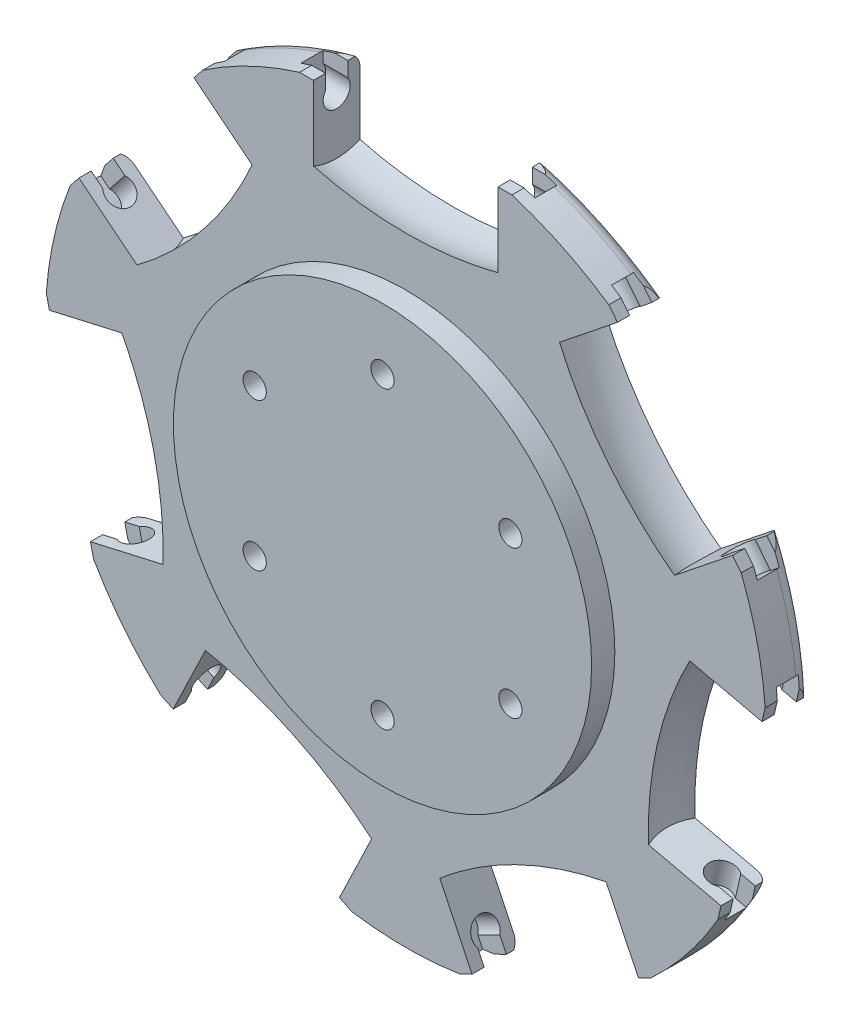
from build123d import *

# Parameters (mm, degrees)
BASE_HEPTAGONAL_DEPTH   = 5
SKETCH8_R               = 15.894039735
RELIEVE_DE_CENTRO_DEPTH = 1.324503311
CIRPATTERN2_COUNT       = 7
CUT_EXTRUDE1_START      = -5.298013245
CUT_EXTRUDE1_DEPTH      = 50.331125828
CIRPATTERN3_COUNT       = 7
SKETCH11_R              = 45.033112583
CUT_EXTRUDE3_DEPTH      = 5
SKETCH12_R              = 2.5
CUT_EXTRUDE4_DEPTH      = 116.148583309
SKETCH13_R              = 87.61589404
SKETCH13_R_2            = 77.61589404
CUT_EXTRUDE_THIN1_DEPTH = 10
SKETCH15_R              = 15.894039735
CUT_EXTRUDE6_DEPTH      = 3.5
FILLET1_R               = 3.178807947
CROQUIS1_R              = 45.0331125
CROQUIS1_R_2            = 2.5
SALIENTE_EXTRUIR1_DEPTH = 5


with BuildPart() as part:
    # Sketch2 → Base heptagonal (new, symmetric)
    with BuildSketch(Plane.XY):
        Polygon((-35.719441925, 74.17218543), (-80.260857461, 18.319016964), (-64.364210306, -51.328744916), (0, -82.324914959), (64.364210306, -51.328744916), (80.260857461, 18.319016964), (35.719441925, 74.17218543), align=None)
    extrude(amount=BASE_HEPTAGONAL_DEPTH, both=True)

    # Sketch3 → Corte De Rodillo (revolve, cut)
    with BuildSketch(Plane.XY):
        with BuildLine():
            Line((-19.870425038, 81.480316053), (-19.870425038, 69.294885589))
            Line((-19.870425038, 69.294885589), (19.870425038, 69.294885589))
            Line((19.870425038, 69.294885589), (19.870425038, 81.480316053))
            ThreePointArc((19.870425038, 81.480316053), (0, 83.868204317), (-19.870425038, 81.480316053))
        make_face()
    corte_de_rodillo = revolve(axis=Axis((-19.870425038, 69.294885589, 0), (1, 0, 0)), mode=Mode.SUBTRACT)

    # Sketch8 → Relieve de Centro (add)
    with BuildSketch(Plane.XY.offset(5)):
        Circle(SKETCH8_R)
    extrude(amount=RELIEVE_DE_CENTRO_DEPTH)

    # CirPattern2: Corte De Rodillo ×7 about axis
    cirpattern2_axis = Axis((0, 0, 0), (0, 0, 1))
    for i in range(1, CIRPATTERN2_COUNT):
        add(corte_de_rodillo.rotate(cirpattern2_axis, i * 360 / CIRPATTERN2_COUNT), mode=Mode.SUBTRACT)

    # Sketch9 → Cut-Extrude1 (cut)
    with BuildSketch(Plane(origin=(-19.870425038, 0, 0), x_dir=(0, 0, -1), z_dir=(1, 0, 0)).offset(CUT_EXTRUDE1_START)):
        with BuildLine():
            Line((2.38410596, 70.970264477), (2.38410596, 74.17218543))
            Line((2.38410596, 74.17218543), (-2.38410596, 74.17218543))
            Line((-2.38410596, 74.17218543), (-2.38410596, 70.970264477))
            ThreePointArc((-2.38410596, 70.970264477), (0, 66.380978308), (2.38410596, 70.970264477))
        make_face()
    cut_extrude1 = extrude(amount=CUT_EXTRUDE1_DEPTH, mode=Mode.SUBTRACT)

    # CirPattern3: Cut-Extrude1 ×7 about axis
    cirpattern3_axis = Axis((0, 0, 0), (0, 0, 1))
    for i in range(1, CIRPATTERN3_COUNT):
        add(cut_extrude1.rotate(cirpattern3_axis, i * 360 / CIRPATTERN3_COUNT), mode=Mode.SUBTRACT)

    # Sketch11 → Cut-Extrude3 (cut)
    with BuildSketch(Plane(origin=(0, 0, -5), x_dir=(-1, 0, 0), z_dir=(0, 0, -1))):
        Circle(SKETCH11_R)
    extrude(amount=-CUT_EXTRUDE3_DEPTH, mode=Mode.SUBTRACT)

    # Sketch12 → Cut-Extrude4 (cut, through all)
    with BuildSketch(Plane(origin=(0, 0, 0), x_dir=(-1, 0, 0), z_dir=(0, 0, -1))):
        with Locations((0, 31.78807947)):
            Circle(SKETCH12_R)
        with Locations((27.529284359, 15.894039735)):
            Circle(SKETCH12_R)
        with Locations((27.529284359, -15.894039735)):
            Circle(SKETCH12_R)
        with Locations((0, -31.78807947)):
            Circle(SKETCH12_R)
        with Locations((-27.529284359, -15.894039735)):
            Circle(SKETCH12_R)
        with Locations((-27.529284359, 15.894039735)):
            Circle(SKETCH12_R)
    extrude(amount=-CUT_EXTRUDE4_DEPTH, mode=Mode.SUBTRACT)

    # Sketch13 → Cut-Extrude-Thin1 (cut)
    with BuildSketch(Plane(origin=(0, 0, -5), x_dir=(-1, 0, 0), z_dir=(0, 0, -1))):
        Circle(SKETCH13_R)
        Circle(SKETCH13_R_2, mode=Mode.SUBTRACT)
    extrude(amount=-CUT_EXTRUDE_THIN1_DEPTH, mode=Mode.SUBTRACT)

    # Sketch15 → Cut-Extrude6 (cut)
    with BuildSketch(Plane.XY.offset(5)):
        Circle(SKETCH15_R)
    extrude(amount=CUT_EXTRUDE6_DEPTH, mode=Mode.SUBTRACT)

    # Fillet1
    # the kernel refuses this fillet: 3.178807947 mm, written as the material it takes off along each edge
    with BuildSketch(Plane(origin=(0, 0, -5), x_dir=(-0.6449730568119215, 0.7642053101010787, 0), z_dir=(-0.7642053101010787, -0.6449730568119215, 0))) as fillet1_piece_1:
        with BuildLine():
            CenterArc((77.61589404 - FILLET1_R, -FILLET1_R), FILLET1_R, 0, 90)
            Line((77.61589404 - FILLET1_R, 0), (77.61589404, 0))
            Line((77.61589404, 0), (77.61589404, -FILLET1_R))
        make_face()
    revolve(axis=Axis((0, 0, -5), (0, 0, -1)), revolution_arc=28.898739355, mode=Mode.SUBTRACT)
    with BuildSketch(Plane(origin=(0, 0, -5), x_dir=(-0.9996138939021527, -0.02778602378491304, 0), z_dir=(0.02778602378491304, -0.9996138939021527, 0))) as fillet1_piece_2:
        with BuildLine():
            CenterArc((77.61589404 - FILLET1_R, -FILLET1_R), FILLET1_R, 0, 90)
            Line((77.61589404 - FILLET1_R, 0), (77.61589404, 0))
            Line((77.61589404, 0), (77.61589404, -FILLET1_R))
        make_face()
    revolve(axis=Axis((0, 0, -5), (0, 0, -1)), revolution_arc=28.898739355, mode=Mode.SUBTRACT)
    with BuildSketch(Plane(origin=(0, 0, -5), x_dir=(-0.6015250804766251, -0.7988539150292685, 0), z_dir=(0.7988539150292685, -0.6015250804766251, 0))) as fillet1_piece_3:
        with BuildLine():
            CenterArc((77.61589404 - FILLET1_R, -FILLET1_R), FILLET1_R, 0, 90)
            Line((77.61589404 - FILLET1_R, 0), (77.61589404, 0))
            Line((77.61589404, 0), (77.61589404, -FILLET1_R))
        make_face()
    revolve(axis=Axis((0, 0, -5), (0, 0, -1)), revolution_arc=28.898739355, mode=Mode.SUBTRACT)
    with BuildSketch(Plane(origin=(0, 0, -5), x_dir=(0.24952438742324118, -0.9683685146064263, 0), z_dir=(0.9683685146064263, 0.24952438742324118, 0))) as fillet1_piece_4:
        with BuildLine():
            CenterArc((77.61589404 - FILLET1_R, -FILLET1_R), FILLET1_R, 0, 90)
            Line((77.61589404 - FILLET1_R, 0), (77.61589404, 0))
            Line((77.61589404, 0), (77.61589404, -FILLET1_R))
        make_face()
    revolve(axis=Axis((0, 0, -5), (0, 0, -1)), revolution_arc=28.898739355, mode=Mode.SUBTRACT)
    with BuildSketch(Plane(origin=(0, 0, -5), x_dir=(0.9126769022235754, -0.4086818715670883, 0), z_dir=(0.4086818715670883, 0.9126769022235754, 0))) as fillet1_piece_5:
        with BuildLine():
            CenterArc((77.61589404 - FILLET1_R, -FILLET1_R), FILLET1_R, 0, 90)
            Line((77.61589404 - FILLET1_R, 0), (77.61589404, 0))
            Line((77.61589404, 0), (77.61589404, -FILLET1_R))
        make_face()
    revolve(axis=Axis((0, 0, -5), (0, 0, -1)), revolution_arc=28.898739355, mode=Mode.SUBTRACT)
    with BuildSketch(Plane(origin=(0, 0, -5), x_dir=(0.8885650944335166, 0.45875055635318374, 0), z_dir=(-0.45875055635318374, 0.8885650944335166, 0))) as fillet1_piece_6:
        with BuildLine():
            CenterArc((77.61589404 - FILLET1_R, -FILLET1_R), FILLET1_R, 0, 90)
            Line((77.61589404 - FILLET1_R, 0), (77.61589404, 0))
            Line((77.61589404, 0), (77.61589404, -FILLET1_R))
        make_face()
    revolve(axis=Axis((0, 0, -5), (0, 0, -1)), revolution_arc=28.898739355, mode=Mode.SUBTRACT)
    with BuildSketch(Plane(origin=(0, 0, -5), x_dir=(0.19534564711037675, 0.9807344585335157, 0), z_dir=(-0.9807344585335157, 0.19534564711037675, 0))) as fillet1_piece_7:
        with BuildLine():
            CenterArc((77.61589404 - FILLET1_R, -FILLET1_R), FILLET1_R, 0, 90)
            Line((77.61589404 - FILLET1_R, 0), (77.61589404, 0))
            Line((77.61589404, 0), (77.61589404, -FILLET1_R))
        make_face()
    revolve(axis=Axis((0, 0, -5), (0, 0, -1)), revolution_arc=28.898739355, mode=Mode.SUBTRACT)

    # Croquis1 → Saliente-Extruir1 (add)
    with BuildSketch(Plane.XY.offset(5)):
        with Locations(Location((0, 0, 0), (0, 0, 180))):
            Circle(CROQUIS1_R)
        with Locations(Location((-27.529284359, -15.894039735, 0), (0, 0, 180))):
            Circle(CROQUIS1_R_2, mode=Mode.SUBTRACT)
        with Locations(Location((0, -31.78807947, 0), (0, 0, 180))):
            Circle(CROQUIS1_R_2, mode=Mode.SUBTRACT)
        with Locations(Location((27.529284359, -15.894039735, 0), (0, 0, 180))):
            Circle(CROQUIS1_R_2, mode=Mode.SUBTRACT)
        with Locations(Location((27.529284359, 15.894039735, 0), (0, 0, 180))):
            Circle(CROQUIS1_R_2, mode=Mode.SUBTRACT)
        with Locations(Location((0, 31.78807947, 0), (0, 0, 180))):
            Circle(CROQUIS1_R_2, mode=Mode.SUBTRACT)
        with Locations(Location((-27.529284359, 15.894039735, 0), (0, 0, 180))):
            Circle(CROQUIS1_R_2, mode=Mode.SUBTRACT)
    extrude(amount=SALIENTE_EXTRUIR1_DEPTH)


solid = part.part
